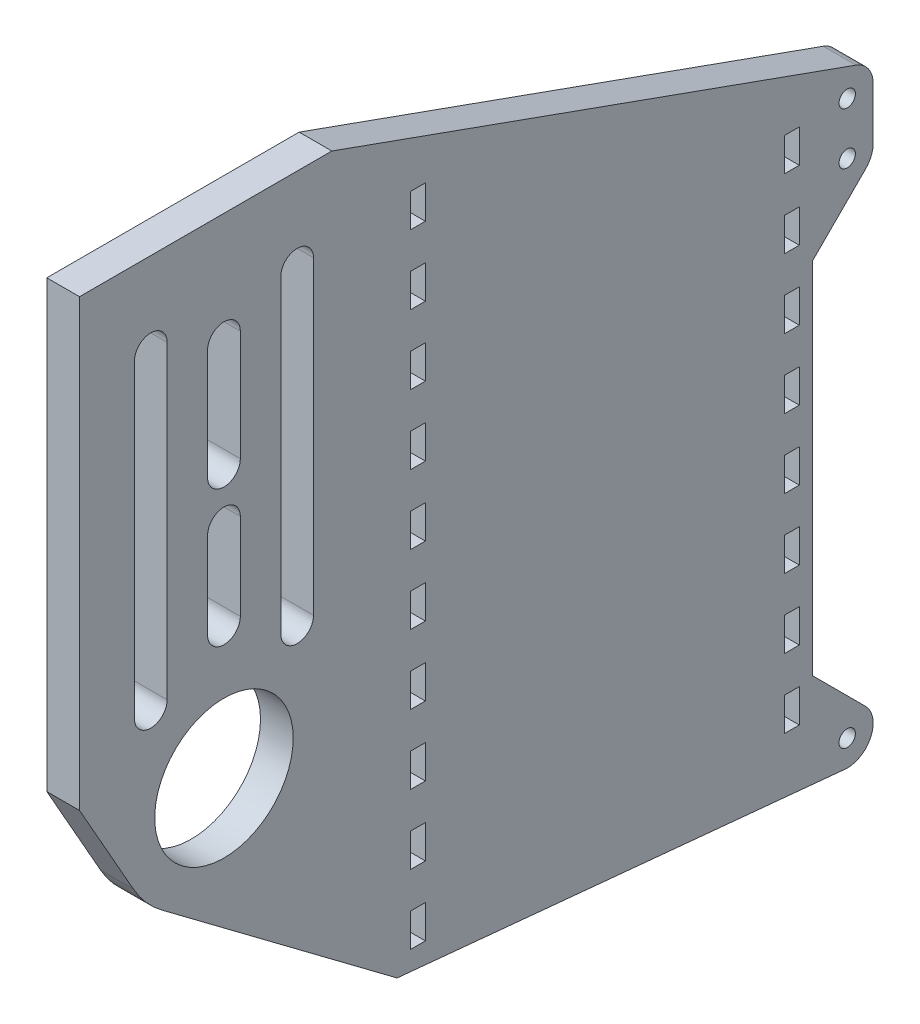
from build123d import *

# Parameters (mm, degrees)
SKETCH4_R           = 1.5
SKETCH4_R_2         = 12.7
BOSS_EXTRUDE1_DEPTH = 3
SKETCH5_W           = 2.75
SKETCH5_H           = 6.096
LOWERSLOT_DEPTH     = 122.522218071
SKETCH5_3_W         = 2.75
SKETCH5_3_H         = 6.096
UPPERSLOT_DEPTH     = 122.522218071
LOWERSLOTS_COUNT    = 8
LOWERSLOTS_PITCH    = 12.7
LPATTERN2_COUNT     = 10
LPATTERN2_PITCH     = 12.7


with BuildPart() as part:
    # Sketch4 → Boss-Extrude1 (new, symmetric)
    with BuildSketch(Plane(origin=(0, 0, 0), x_dir=(0, 0, -1), z_dir=(1, 0, 0))):
        with BuildLine():
            ThreePointArc((47.817596045, 22.032403955), (48.849976274, 23.577470153), (49.2125, 25.4))
            Line((49.2125, 25.4), (49.2125, 34.925))
            ThreePointArc((49.2125, 34.925), (48.344113354, 37.66676721), (46.055633886, 39.40867551))
            Line((46.055633886, 39.40867551), (-50.063626234, 73.829618952))
            Line((-50.063626234, 73.829618952), (-96.337100071, 73.829618952))
            Line((-96.337100071, 73.829618952), (-96.337100071, -7.774310331))
            Line((-96.337100071, -7.774310331), (-86.423631694, -25.267402912))
            ThreePointArc((-86.423631694, -25.267402912), (-84.153826234, -28.456854198), (-81.28, -31.115))
            Line((-81.28, -31.115), (-38.1, -63.5))
            Line((-38.1, -63.5), (43.992912904, -71.415514491))
            ThreePointArc((43.992912904, -71.415514491), (48.757334408, -68.706816071), (47.817596045, -63.307403955))
            Line((47.817596045, -63.307403955), (38.1, -53.589807909))
            Line((38.1, -53.589807909), (38.1, 12.314807909))
            Line((38.1, 12.314807909), (47.817596045, 22.032403955))
        make_face()
        with Locations((44.45, -66.675)):
            Circle(SKETCH4_R, mode=Mode.SUBTRACT)
        with BuildLine():
            ThreePointArc((-80.273393759, 1.775), (-83.273393759, -1.225), (-86.273393759, 1.775))
            Line((-86.273393759, 1.775), (-86.273393759, 58.55))
            ThreePointArc((-86.273393759, 58.55), (-83.273393759, 61.55), (-80.273393759, 58.55))
            Line((-80.273393759, 58.55), (-80.273393759, 1.775))
        make_face(mode=Mode.SUBTRACT)
        with BuildLine():
            ThreePointArc((-66.85, 8.3125), (-69.85, 5.3125), (-72.85, 8.3125))
            Line((-72.85, 8.3125), (-72.85, 24.1875))
            ThreePointArc((-72.85, 24.1875), (-69.85, 27.1875), (-66.85, 24.1875))
            Line((-66.85, 24.1875), (-66.85, 8.3125))
        make_face(mode=Mode.SUBTRACT)
        with BuildLine():
            Line((-66.85, 53.6), (-66.85, 33.3625))
            ThreePointArc((-66.85, 33.3625), (-69.85, 30.3625), (-72.85, 33.3625))
            Line((-72.85, 33.3625), (-72.85, 53.6))
            ThreePointArc((-72.85, 53.6), (-69.85, 56.6), (-66.85, 53.6))
        make_face(mode=Mode.SUBTRACT)
        with BuildLine():
            ThreePointArc((-53.426606241, 1.775), (-56.426606241, -1.225), (-59.426606241, 1.775))
            Line((-59.426606241, 1.775), (-59.426606241, 58.55))
            ThreePointArc((-59.426606241, 58.55), (-56.426606241, 61.55), (-53.426606241, 58.55))
            Line((-53.426606241, 58.55), (-53.426606241, 1.775))
        make_face(mode=Mode.SUBTRACT)
        with Locations((44.45, 25.4)):
            Circle(SKETCH4_R, mode=Mode.SUBTRACT)
        with Locations((44.45, 34.925)):
            Circle(SKETCH4_R, mode=Mode.SUBTRACT)
        with Locations((-69.85, -15.875)):
            Circle(SKETCH4_R_2, mode=Mode.SUBTRACT)
    extrude(amount=BOSS_EXTRUDE1_DEPTH, both=True)

    # Sketch5 → LowerSlot (cut, symmetric)
    with BuildSketch(Plane(origin=(3, 0, 0), x_dir=(0, 0, -1), z_dir=(1, 0, 0))):
        with Locations((34.29, -57.15)):
            Rectangle(SKETCH5_W, SKETCH5_H)
    lowerslot = extrude(amount=LOWERSLOT_DEPTH, both=True, mode=Mode.SUBTRACT)

    # Sketch5<3> → UpperSlot (cut, symmetric)
    with BuildSketch(Plane(origin=(3, 0, 0), x_dir=(0, 0, -1), z_dir=(1, 0, 0))):
        with Locations((-34.29, -57.15)):
            Rectangle(SKETCH5_3_W, SKETCH5_3_H)
    upperslot = extrude(amount=UPPERSLOT_DEPTH, both=True, mode=Mode.SUBTRACT)

    # LowerSlots: LowerSlot ×8
    with Locations(*[(0, i * LOWERSLOTS_PITCH, 0) for i in range(1, LOWERSLOTS_COUNT)]):
        add(lowerslot, mode=Mode.SUBTRACT)

    # LPattern2: UpperSlot ×10
    with Locations(*[(0, i * LPATTERN2_PITCH, 0) for i in range(1, LPATTERN2_COUNT)]):
        add(upperslot, mode=Mode.SUBTRACT)


solid = part.part
